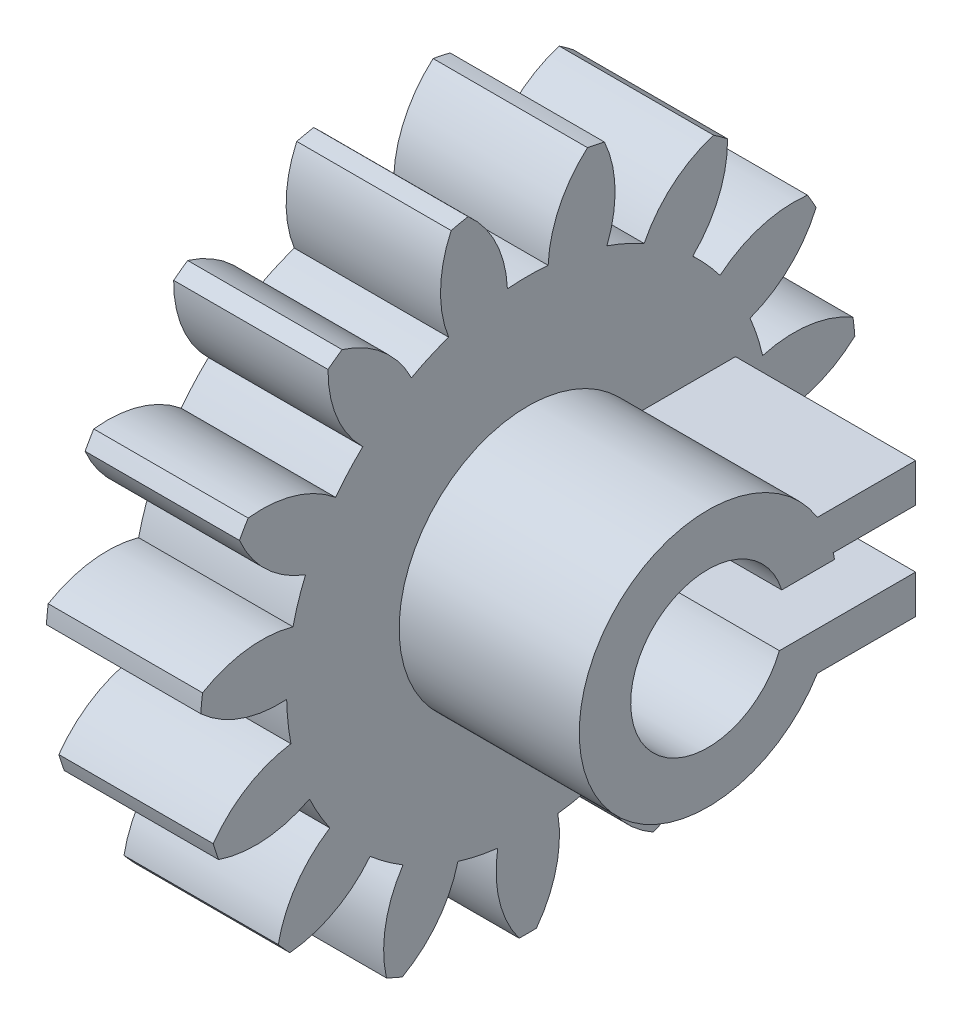
from build123d import *

# Parameters (mm, degrees)
BASPROSKE_W         = 6
BASPROSKE_H         = 12.75
TOOTHCUT_DEPTH      = 20.003289189
TEETHCUTS_COUNT     = 15
TEETHCUTS_ANGLE     = 336
BORSKE_R            = 3
BORE_DEPTH          = 50.0000508
BOSS_EXTRUDE1_START = 7
SKETCH1_R           = 5
SKETCH1_R_2         = 3
BOSS_EXTRUDE1_DEPTH = 7
CUT_EXTRUDE1_START  = -7
CUT_EXTRUDE1_DEPTH  = 7
SKETCH3_W           = 7
SKETCH3_H           = 5.292923502
BOSS_EXTRUDE2_DEPTH = 1.5


# Read off the part's stored shape, not the designer's step: Cut-Extrude1
with BuildPart() as part:
    # BasProSke → Base-Revolve (revolve)
    with BuildSketch(Plane(origin=(0, 0, 0), x_dir=(1, 0, 0), z_dir=(0, 1, 0)), mode=Mode.PRIVATE) as base_revolve_sk:
        with Locations((3, 6.375)):
            Rectangle(BASPROSKE_W, BASPROSKE_H)
    revolve(base_revolve_sk.sketch.rotate(Axis((-10, 0, 0), (1, 0, 0)), 180), axis=Axis((-10, 0, 0), (1, 0, 0)))

    # TooCutSke → ToothCut (cut, through all)
    with BuildSketch(Plane(origin=(0, 0, 0), x_dir=(0, 0, -1), z_dir=(1, 0, 0))):
        with BuildLine():
            ThreePointArc((0.791546546, 9.340520867), (0, 9.374), (-0.791546546, 9.340520867))
            ThreePointArc((-0.791546546, 9.340520867), (-1.235070734, 11.110218102), (-2.344732916, 12.558386549))
            ThreePointArc((-2.344732916, 12.558386549), (0, 12.7754), (2.344732916, 12.558386549))
            ThreePointArc((2.344732916, 12.558386549), (1.235070734, 11.110218102), (0.791546546, 9.340520867))
        make_face()
    toothcut = extrude(amount=TOOTHCUT_DEPTH, mode=Mode.SUBTRACT)

    # TeethCuts: ToothCut ×15 about axis
    teethcuts_axis = Axis((-10, 0, 0), (1, 0, 0))
    for i in range(1, TEETHCUTS_COUNT):
        add(toothcut.rotate(teethcuts_axis, i * TEETHCUTS_ANGLE / (TEETHCUTS_COUNT - 1)), mode=Mode.SUBTRACT)

    # BorSke → Bore (cut, symmetric)
    with BuildSketch(Plane(origin=(0, 0, 0), x_dir=(0, 0, -1), z_dir=(1, 0, 0))):
        with Locations(Location((0, 0, 0), (0, 0, 180))):
            Circle(BORSKE_R)
    extrude(amount=BORE_DEPTH, both=True, mode=Mode.SUBTRACT)

    # Sketch1 → Boss-Extrude1 (add)
    with BuildSketch(Plane(origin=(6, 0, 0), x_dir=(0, 0, -1), z_dir=(1, 0, 0)).offset(BOSS_EXTRUDE1_START)):
        with Locations(Location((0, 0, 0), (0, 0, 180))):
            Circle(SKETCH1_R)
        Circle(SKETCH1_R_2, mode=Mode.SUBTRACT)
    extrude(amount=-BOSS_EXTRUDE1_DEPTH)

    # Cut-Extrude1 outline → Cut-Extrude1 (cut)
    with BuildSketch(Plane(origin=(13, 0, 0), x_dir=(0, 0, -1), z_dir=(1, 0, 0)).offset(CUT_EXTRUDE1_START)):
        with BuildLine():
            ThreePointArc((2.869678463, 0.874611639), (2.997049903, -0.133010816), (2.780917301, -1.125388361))
            Line((2.780917301, -1.125388361), (4.87170412, -1.125388361))
            ThreePointArc((4.87170412, -1.125388361), (4.998361954, -0.127975708), (4.922911179, 0.874611639))
            Line((4.922911179, 0.874611639), (2.869678463, 0.874611639))
        make_face()
    extrude(amount=CUT_EXTRUDE1_DEPTH, mode=Mode.SUBTRACT)

    # Sketch3 → Boss-Extrude2 (add)
    with BuildSketch(Plane(origin=(0, -1.125388361, 0), x_dir=(1, 0, 0), z_dir=(0, 1, 0))):
        with Locations((9.5, 5.427379052)):
            Rectangle(SKETCH3_W, SKETCH3_H)
    boss_extrude2 = extrude(amount=-BOSS_EXTRUDE2_DEPTH)

    # Mirror2: Boss-Extrude2 across plane
    add(boss_extrude2.mirror(Plane.ZX))


solid = part.part
